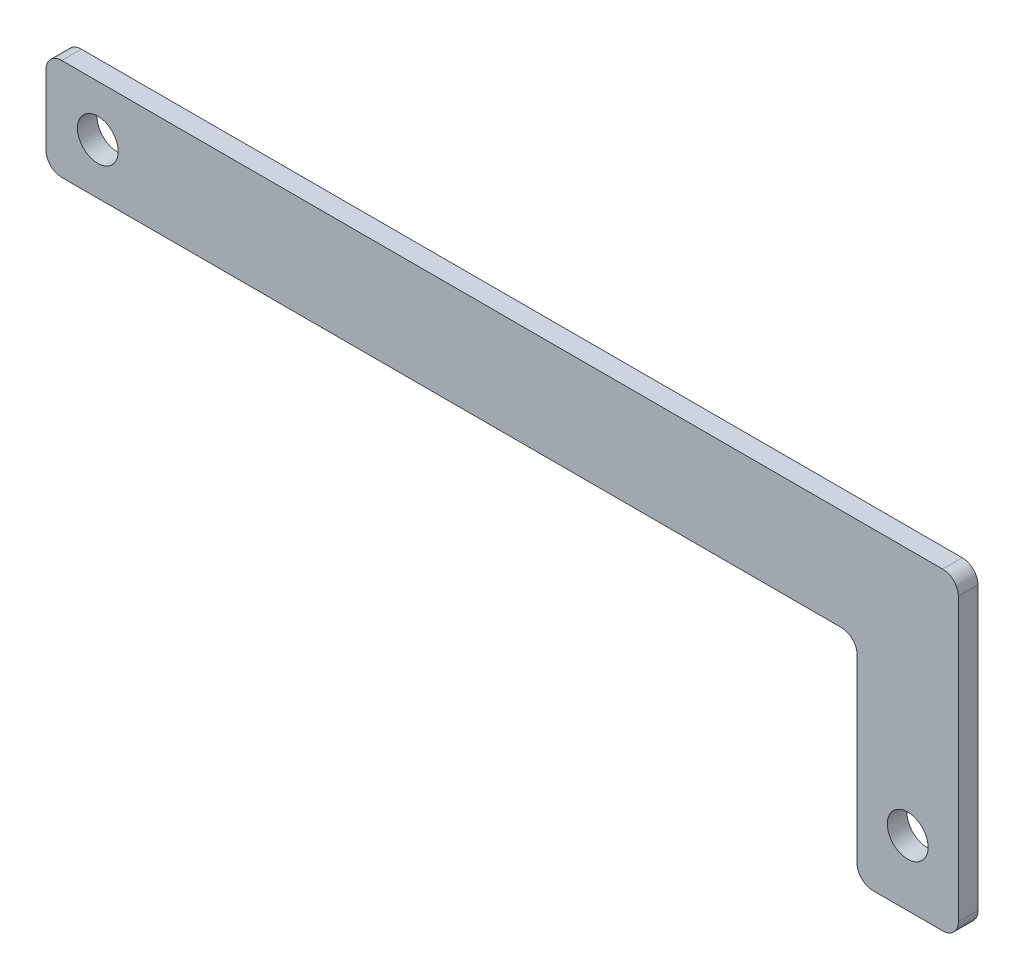
from build123d import *

# Parameters (mm, degrees)
BASE_FLANGE1_DEPTH   = 3.175
M6_CLEARANCE_HOLE1_D = 6.6
FILLET1_R            = 2.54


# Sheet-metal steps are written as plain solids
with BuildPart() as part:
    # Sketch1 → Base-Flange1 (new body)
    with BuildSketch(Plane.XY):
        Polygon((108.371719048, -78.501600001), (-22.7939, -78.501600001), (-22.7939, -62.123600001), (124.749719048, -62.123600001), (124.749719048, -112.791600001), (108.371719048, -112.791600001), align=None)
    extrude(amount=-BASE_FLANGE1_DEPTH)

    # M6 Clearance Hole1 (through all)
    with Locations(Plane.XY):
        with Locations((-14.4119, -70.312600001), (116.560719048, -102.268610498)):
            Hole(M6_CLEARANCE_HOLE1_D / 2)

    # Fillet1
    fillet1_edges = [part.edges().sort_by_distance(p)[0] for p in [
        (-22.7939, -62.123600001, -1.5875),
        (124.749719048, -62.123600001, -1.5875),
        (124.749719048, -112.791600001, -1.5875),
        (108.371719048, -112.791600001, -1.5875),
        (108.371719048, -78.501600001, -1.5875),
        (-22.7939, -78.501600001, -1.5875),
    ]]
    fillet(fillet1_edges, radius=FILLET1_R)


solid = part.part
